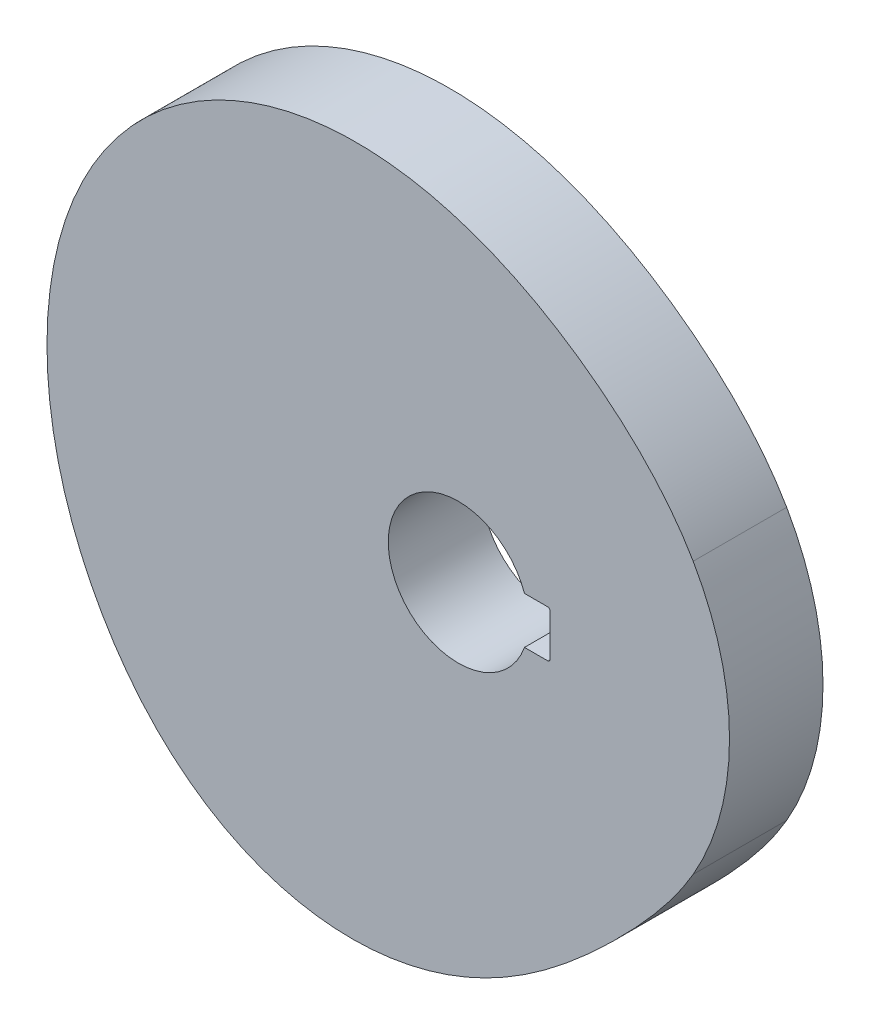
from build123d import *

# Parameters (mm, degrees)
BOSS_EXTRUDE1_DEPTH            = 5
CUT_EXTRUDE2_REACH             = 102.861
SKETCH2_R                      = 7.5
CUT_EXTRUDE2_DIRECTION_2_REACH = 102.861
CUT_EXTRUDE3_REACH             = 102.861
SKETCH3_W                      = 2.728932188
SKETCH3_H                      = 5
CUT_EXTRUDE3_DIRECTION_2_REACH = 102.861
FILLET1_R                      = 0.25


with BuildPart() as part:
    # Cam Profile Sketch → Boss-Extrude1 (new, symmetric)
    with BuildSketch(Plane.XY):
        with BuildLine():
            ThreePointArc((-93, 0), (-91.500736357, -11.388037985), (-87.105117767, -22))
            add(Edge.make_bspline(
                [(-23.88526329, -14.5), (-23.922791175, -14.565000204), (-23.998649412, -14.694954775), (-24.15332125, -14.956451732), (-24.340525283, -15.263898557), (-24.5244885, -15.557703736), (-24.715431859, -15.855805539), (-24.909614855, -16.15195987), (-25.203984047, -16.590758834), (-25.555498554, -17.09633229), (-26.070029785, -17.807513626), (-26.655526563, -18.574359672), (-27.201569758, -19.259834849), (-27.98449394, -20.206335342), (-28.90502726, -21.271820048), (-29.972740995, -22.445007703), (-31.191872601, -23.720434386), (-32.313236495, -24.848353777), (-33.326369934, -25.834408184), (-34.355969836, -26.80326528), (-35.402716561, -27.753587294), (-36.467680048, -28.683473207), (-37.552135299, -29.590582699), (-38.657401747, -30.472253073), (-40.066539186, -31.538937619), (-41.514159492, -32.553381391), (-43.299878611, -33.698704783), (-45.495184236, -34.939076695), (-47.764567125, -36.04135913), (-50.445821668, -37.085049597), (-53.207528316, -37.892804506), (-55.985154603, -38.441787906), (-58.802128165, -38.72980757), (-61.633982892, -38.745729011), (-64.453847967, -38.483175564), (-67.30370564, -37.927366379), (-69.776848702, -37.172850633), (-71.877507778, -36.32386857), (-73.624867165, -35.46667591), (-75.324016902, -34.517551125), (-76.953570999, -33.451250635), (-78.5066057, -32.276603359), (-79.978445706, -31.003403234), (-80.96489682, -30.063893032), (-81.7785074, -29.226676599), (-82.435115711, -28.508913523), (-82.947471258, -27.923248411), (-83.444094835, -27.329888306), (-83.924996006, -26.729970308), (-84.39095402, -26.123304355), (-84.841340382, -25.512138641), (-85.280722153, -24.89032365), (-85.706158879, -24.263542751), (-86.122953909, -23.623221102), (-86.47327305, -23.063445279), (-86.76581223, -22.580010581), (-86.982737459, -22.210875173), (-87.064771918, -22.06988106), (-87.105117767, -22)],
                knots=[0.065589118, 0.065589118, 0.065589118, 0.065589118, 0.065589118, 0.069408035, 0.073226953, 0.07704587, 0.080864787, 0.084683704, 0.088502622, 0.092321539, 0.103715684, 0.111290912, 0.126441368, 0.134016596, 0.141591824, 0.16438011, 0.187293602, 0.202569262, 0.217844923, 0.23312059, 0.248396257, 0.263671924, 0.278947591, 0.294223264, 0.309498937, 0.32477461, 0.355325952, 0.370601622, 0.40115296, 0.43370758, 0.464259044, 0.494810317, 0.525361756, 0.555913058, 0.586464489, 0.617015808, 0.647567199, 0.681199756, 0.698016054, 0.714832353, 0.731648649, 0.765281239, 0.782097533, 0.798913826, 0.81573012, 0.824138267, 0.832546413, 0.840954559, 0.849362706, 0.857574064, 0.865785423, 0.873996781, 0.882208139, 0.890419498, 0.898630856, 0.906842214, 0.910947893, 0.915053573, 0.915053573, 0.915053573, 0.915053573, 0.915053573], degree=4))
            ThreePointArc((-23.88526329, -14.5), (-20, 0), (-23.88526329, 14.5))
            add(Edge.make_bspline(
                [(-23.88526329, 14.5), (-23.932833241, 14.582393572), (-24.027735632, 14.744459437), (-24.231925624, 15.087793303), (-24.46450917, 15.463371132), (-24.703390562, 15.836615788), (-24.951207174, 16.212346325), (-25.203484431, 16.583064674), (-25.46074277, 16.949924901), (-25.751215861, 17.352353664), (-26.267739786, 18.045259905), (-27.13242898, 19.136824201), (-28.416457056, 20.609341935), (-30.145620673, 22.368287275), (-31.952150626, 24.000291025), (-33.681967176, 25.41571585), (-35.282945482, 26.620318655), (-36.734616368, 27.636989184), (-38.213978733, 28.600036393), (-39.725583036, 29.511671335), (-41.268408172, 30.369454805), (-43.234779278, 31.370683062), (-45.652824117, 32.452029329), (-48.553542267, 33.52297114), (-51.603171336, 34.358113779), (-54.342307474, 34.879685008), (-57.109687749, 35.211043587), (-59.895053033, 35.345703407), (-63.055990569, 35.221736141), (-66.555662216, 34.713175175), (-69.980673903, 33.83134164), (-73.288914905, 32.580231182), (-76.438740161, 30.971168835), (-79.408761983, 29.010524564), (-82.158177024, 26.71658369), (-84.649562025, 24.114483862), (-86.850503307, 21.235390487), (-88.726388176, 18.135105853), (-90.207243152, 14.978600915), (-91.201235594, 12.185914914), (-91.846971882, 9.831440612), (-92.220923851, 8.109402622), (-92.439008765, 6.908922137), (-92.599303538, 5.858959769), (-92.715551891, 4.962184129), (-92.7997669, 4.175514311), (-92.859593934, 3.499890001), (-92.901288102, 2.936462797), (-92.929777786, 2.485415011), (-92.95343395, 2.032738397), (-92.972289434, 1.58121932), (-92.986377752, 1.138948098), (-92.995733053, 0.670823473), (-92.999225819, 0.290111955), (-93, 0.095946687), (-93, 0)],
                knots=[0.06618795, 0.06618795, 0.06618795, 0.06618795, 0.06618795, 0.07009879, 0.074009629, 0.077920468, 0.081831307, 0.085742146, 0.089652985, 0.093563824, 0.097474663, 0.103058587, 0.119810359, 0.142146056, 0.165611089, 0.189076123, 0.204719479, 0.220116153, 0.235512827, 0.250909501, 0.266306175, 0.281702859, 0.297099544, 0.327892913, 0.358686295, 0.389479678, 0.407290642, 0.425101606, 0.455894993, 0.486688357, 0.517481849, 0.548275211, 0.579068582, 0.609862016, 0.640655445, 0.672207426, 0.703759507, 0.735311515, 0.766863568, 0.798415597, 0.825209783, 0.838606877, 0.85200397, 0.859891976, 0.867779982, 0.875667988, 0.883555994, 0.887499997, 0.891444, 0.895388003, 0.899332006, 0.903276009, 0.907220011, 0.911164014, 0.915108017, 0.915108017, 0.915108017, 0.915108017, 0.915108017], degree=4))
        make_face()
    extrude(amount=BOSS_EXTRUDE1_DEPTH, both=True)

    # Sketch2 → Cut-Extrude2 (cut, up to next)
    with BuildSketch(Plane.XY, mode=Mode.PRIVATE) as cut_extrude2_sk1:
        with Locations((-49, 0)):
            Circle(SKETCH2_R)
    cut_extrude2_tool1 = extrude(cut_extrude2_sk1.sketch, amount=-CUT_EXTRUDE2_REACH, mode=Mode.PRIVATE) & part.part
    add(cut_extrude2_tool1.solids().sort_by_distance((-49, 0, 0))[0], mode=Mode.SUBTRACT)

    # Sketch2 → Cut-Extrude2 direction 2 (cut, up to next)
    with BuildSketch(Plane.XY, mode=Mode.PRIVATE) as cut_extrude2_direction_2_sk1:
        with Locations((-49, 0)):
            Circle(SKETCH2_R)
    cut_extrude2_direction_2_tool1 = extrude(cut_extrude2_direction_2_sk1.sketch, amount=CUT_EXTRUDE2_DIRECTION_2_REACH, mode=Mode.PRIVATE) & part.part
    add(cut_extrude2_direction_2_tool1.solids().sort_by_distance((-49, 0, 0))[0], mode=Mode.SUBTRACT)

    # Sketch3 → Cut-Extrude3 (cut, up to next)
    with BuildSketch(Plane.XY, mode=Mode.PRIVATE) as cut_extrude3_sk1:
        with Locations((-40.564466094, 0)):
            Rectangle(SKETCH3_W, SKETCH3_H)
    cut_extrude3_tool1 = extrude(cut_extrude3_sk1.sketch, amount=-CUT_EXTRUDE3_REACH, mode=Mode.PRIVATE) & part.part
    add(cut_extrude3_tool1.solids().sort_by_distance((-40.564466, 0, 0))[0], mode=Mode.SUBTRACT)

    # Sketch3 → Cut-Extrude3 direction 2 (cut, up to next)
    with BuildSketch(Plane.XY, mode=Mode.PRIVATE) as cut_extrude3_direction_2_sk1:
        with Locations((-40.564466094, 0)):
            Rectangle(SKETCH3_W, SKETCH3_H)
    cut_extrude3_direction_2_tool1 = extrude(cut_extrude3_direction_2_sk1.sketch, amount=CUT_EXTRUDE3_DIRECTION_2_REACH, mode=Mode.PRIVATE) & part.part
    add(cut_extrude3_direction_2_tool1.solids().sort_by_distance((-40.564466, 0, 0))[0], mode=Mode.SUBTRACT)

    # Fillet1
    fillet1_edges = [part.edges().sort_by_distance(p)[0] for p in [
        (-39.2, -2.5, 0),
        (-39.2, 2.5, 0),
    ]]
    fillet(fillet1_edges, radius=FILLET1_R)


solid = part.part
